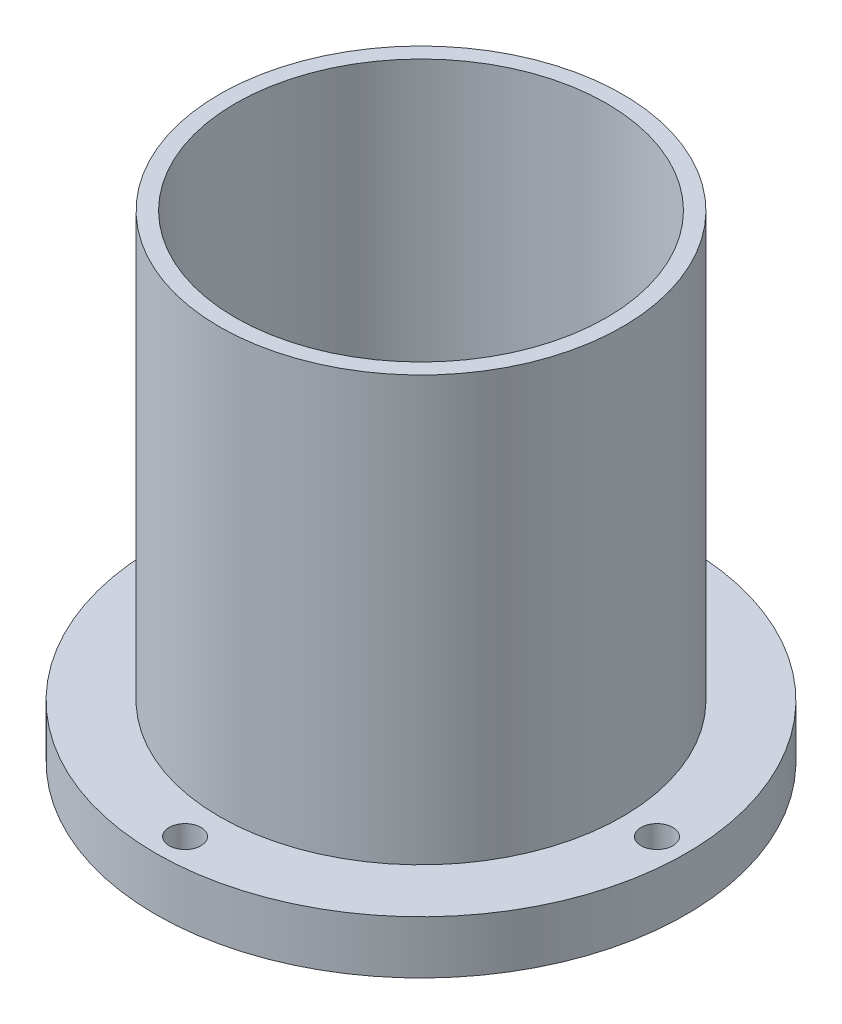
from build123d import *

# Parameters (mm, degrees)
SKETCH1_R           = 50
BOSS_EXTRUDE1_DEPTH = 10
SKETCH2_R           = 3
CUT_EXTRUDE1_DEPTH  = 10
SKETCH3_R           = 38
SKETCH3_R_2         = 35
BOSS_EXTRUDE2_DEPTH = 80


with BuildPart() as part:
    # Sketch1 → Boss-Extrude1 (new body)
    with BuildSketch(Plane(origin=(0, 0, 0), x_dir=(1, 0, 0), z_dir=(0, 1, 0))):
        Circle(SKETCH1_R)
    extrude(amount=BOSS_EXTRUDE1_DEPTH)

    # Sketch2 → Cut-Extrude1 (cut)
    with BuildSketch(Plane(origin=(0, 10, 0), x_dir=(1, 0, 0), z_dir=(0, 1, 0))):
        with Locations((-44.5, 0)):
            Circle(SKETCH2_R)
        with Locations((0, 44.5)):
            Circle(SKETCH2_R)
        with Locations((44.5, 0)):
            Circle(SKETCH2_R)
        with Locations((0, -44.5)):
            Circle(SKETCH2_R)
    extrude(amount=-CUT_EXTRUDE1_DEPTH, mode=Mode.SUBTRACT)

    # Sketch3 → Boss-Extrude2 (add)
    with BuildSketch(Plane(origin=(0, 10, 0), x_dir=(1, 0, 0), z_dir=(0, 1, 0))):
        Circle(SKETCH3_R)
        Circle(SKETCH3_R_2, mode=Mode.SUBTRACT)
    extrude(amount=BOSS_EXTRUDE2_DEPTH)


solid = part.part
